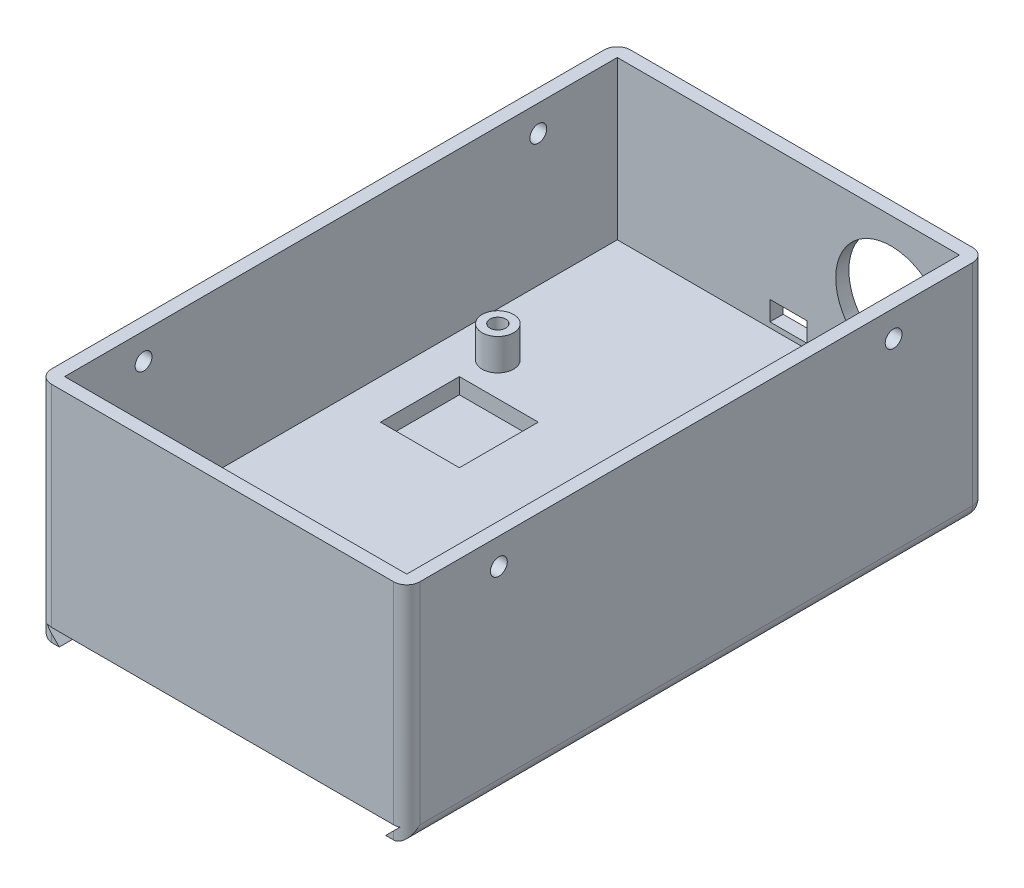
from build123d import *

# Parameters (mm, degrees)
SKETCH3_W           = 70
SKETCH3_H           = 110
BOSS_EXTRUDE1_DEPTH = 3
SKETCH4_W           = 2.5
SKETCH4_H           = 105
BOSS_EXTRUDE2_DEPTH = 30
SKETCH5_R           = 3
BOSS_EXTRUDE3_DEPTH = 6
SKETCH7_W           = 70
SKETCH7_H           = 110
SKETCH7_W_2         = 65
SKETCH7_H_2         = 52.5
SKETCH7_H_3         = 50
BOSS_EXTRUDE4_DEPTH = 9.5
SKETCH8_W           = 15
SKETCH8_H           = 6
CUT_EXTRUDE2_DEPTH  = 2.5
SKETCH9_W           = 15
SKETCH9_H           = 15
CUT_EXTRUDE3_DEPTH  = 3
SKETCH10_W          = 1.5
SKETCH10_H          = 50
BOSS_EXTRUDE5_DEPTH = 9.5
SKETCH11_W          = 31
SKETCH11_H          = 2.5
CUT_EXTRUDE5_DEPTH  = 52.5
SKETCH12_R          = 3.5
BOSS_EXTRUDE6_DEPTH = 7
SKETCH15_R          = 1.5
CUT_EXTRUDE6_DEPTH  = 6
SKETCH16_W          = 65
SKETCH16_H          = 2.5
BOSS_EXTRUDE7_DEPTH = 52.5
SKETCH17_R          = 1.6
CUT_EXTRUDE7_DEPTH  = 95.942087611
SKETCH18_W          = 7
SKETCH18_H          = 3.7
CUT_EXTRUDE8_DEPTH  = 2.5
SKETCH19_R          = 1.5
CUT_EXTRUDE9_DEPTH  = 6
SKETCH20_R          = 10.5
CUT_EXTRUDE10_DEPTH = 2.5
FILLET2_R           = 2.5
FILLET3_R           = 2.5


with BuildPart() as part:
    # Sketch3 → Boss-Extrude1 (new body)
    with BuildSketch(Plane(origin=(0, 0, 0), x_dir=(1, 0, 0), z_dir=(0, 1, 0))):
        Rectangle(SKETCH3_W, SKETCH3_H)
    extrude(amount=BOSS_EXTRUDE1_DEPTH)

    # Sketch4 → Boss-Extrude2 (add)
    with BuildSketch(Plane(origin=(0, 3, 0), x_dir=(1, 0, 0), z_dir=(0, 1, 0))):
        with Locations((-33.75, 0)):
            Rectangle(SKETCH4_W, SKETCH4_H)
        Polygon((35, 55), (-35, 55), (-35, 52.5), (-32.5, 52.5), (32.5, 52.5), (35, 52.5), align=None)
        Polygon((35, -55), (35, 52.5), (32.5, 52.5), (32.5, -52.5), (32.5, -55), align=None)
        Polygon((-32.5, -52.5), (-35, -52.5), (-35, -55), (32.5, -55), (32.5, -52.5), align=None)
    extrude(amount=BOSS_EXTRUDE2_DEPTH)

    # Sketch5 → Boss-Extrude3 (add)
    with BuildSketch(Plane(origin=(0, 3, 0), x_dir=(1, 0, 0), z_dir=(0, 1, 0))):
        with Locations(Location((-24.06, 21.37, 0), (0, 0, 90))):
            Circle(SKETCH5_R)
        with Locations(Location((23.57, 21.37, 0), (0, 0, 90))):
            Circle(SKETCH5_R)
        with Locations(Location((23.57, -45.31, 0), (0, 0, 90))):
            Circle(SKETCH5_R)
        with Locations(Location((-24.06, -45.31, 0), (0, 0, 90))):
            Circle(SKETCH5_R)
    extrude(amount=BOSS_EXTRUDE3_DEPTH)

    # Sketch7 → Boss-Extrude4 (add)
    with BuildSketch(Plane.XZ):
        Rectangle(SKETCH7_W, SKETCH7_H)
        with Locations((0, -26.25)):
            Rectangle(SKETCH7_W_2, SKETCH7_H_2, mode=Mode.SUBTRACT)
        with Locations((0, 27.5)):
            Rectangle(SKETCH7_W_2, SKETCH7_H_3, mode=Mode.SUBTRACT)
    extrude(amount=BOSS_EXTRUDE4_DEPTH)

    # Sketch8 → Cut-Extrude2 (cut)
    with BuildSketch(Plane.XY.offset(2.5)):
        with Locations((17.5, -3)):
            Rectangle(SKETCH8_W, SKETCH8_H)
        with Locations((-17.5, -3)):
            Rectangle(SKETCH8_W, SKETCH8_H)
    extrude(amount=-CUT_EXTRUDE2_DEPTH, mode=Mode.SUBTRACT)

    # Sketch9 → Cut-Extrude3 (cut)
    with BuildSketch(Plane.XZ):
        with Locations((-17.5, -7.5)):
            Rectangle(SKETCH9_W, SKETCH9_H)
        with Locations((17.5, -7.5)):
            Rectangle(SKETCH9_W, SKETCH9_H)
    extrude(amount=-CUT_EXTRUDE3_DEPTH, mode=Mode.SUBTRACT)

    # Sketch10 → Boss-Extrude5 (add)
    with BuildSketch(Plane.XZ):
        with Locations((-31.75, 27.5)):
            Rectangle(SKETCH10_W, SKETCH10_H)
        with Locations((31.75, 27.5)):
            Rectangle(SKETCH10_W, SKETCH10_H)
    extrude(amount=BOSS_EXTRUDE5_DEPTH)

    # Sketch11 → Cut-Extrude5 (cut)
    with BuildSketch(Plane.XY.offset(55)):
        with Locations((-15.5, -8.25)):
            Rectangle(SKETCH11_W, SKETCH11_H)
        Polygon((-33.5, -7), (-31, -9.5), (-31, -7), align=None)
        with Locations((15.5, -8.25)):
            Rectangle(SKETCH11_W, SKETCH11_H)
        Polygon((31, -7), (31, -9.5), (33.5, -7), align=None)
    extrude(amount=-CUT_EXTRUDE5_DEPTH, mode=Mode.SUBTRACT)

    # Sketch12 → Boss-Extrude6 (add)
    with BuildSketch(Plane.XZ):
        with Locations(Location((0, 48, 0), (0, 0, 270))):
            Circle(SKETCH12_R)
    extrude(amount=BOSS_EXTRUDE6_DEPTH)

    # Sketch15 → Cut-Extrude6 (cut)
    with BuildSketch(Plane.XZ.offset(7)):
        with Locations(Location((0, 48, 0), (0, 0, 270))):
            Circle(SKETCH15_R)
    extrude(amount=-CUT_EXTRUDE6_DEPTH, mode=Mode.SUBTRACT)

    # Sketch16 → Boss-Extrude7 (add)
    with BuildSketch(Plane.XY.offset(-52.5)):
        with Locations((0, -8.25)):
            Rectangle(SKETCH16_W, SKETCH16_H)
    extrude(amount=BOSS_EXTRUDE7_DEPTH)

    # Sketch17 → Cut-Extrude7 (cut, through all)
    with BuildSketch(Plane.ZY.offset(35)):
        with Locations((-37.5, 28)):
            Circle(SKETCH17_R)
        with Locations((37.5, 28)):
            Circle(SKETCH17_R)
    extrude(amount=-CUT_EXTRUDE7_DEPTH, mode=Mode.SUBTRACT)

    # Sketch18 → Cut-Extrude8 (cut)
    with BuildSketch(Plane(origin=(0, 0, -55), x_dir=(-1, 0, 0), z_dir=(0, 0, -1))):
        with Locations((0, 5.85)):
            Rectangle(SKETCH18_W, SKETCH18_H)
    extrude(amount=-CUT_EXTRUDE8_DEPTH, mode=Mode.SUBTRACT)

    # Sketch19 → Cut-Extrude9 (cut)
    with BuildSketch(Plane(origin=(0, 9, 0), x_dir=(1, 0, 0), z_dir=(0, 1, 0))):
        with Locations(Location((-24.06, -45.31, 0), (0, 0, 270))):
            Circle(SKETCH19_R)
        with Locations(Location((-24.06, 21.37, 0), (0, 0, 270))):
            Circle(SKETCH19_R)
        with Locations(Location((23.57, 21.37, 0), (0, 0, 270))):
            Circle(SKETCH19_R)
        with Locations(Location((23.57, -45.31, 0), (0, 0, 270))):
            Circle(SKETCH19_R)
    extrude(amount=-CUT_EXTRUDE9_DEPTH, mode=Mode.SUBTRACT)

    # Sketch20 → Cut-Extrude10 (cut)
    with BuildSketch(Plane(origin=(0, 0, -55), x_dir=(-1, 0, 0), z_dir=(0, 0, -1))):
        with Locations((-19.5, 17.5)):
            Circle(SKETCH20_R)
    extrude(amount=-CUT_EXTRUDE10_DEPTH, mode=Mode.SUBTRACT)

    # Fillet2
    # the kernel refuses this fillet: 2.5 mm, written as the material it takes off along each edge
    with BuildSketch(Plane(origin=(-35, -15.75, -55), x_dir=(1, 0, 0), z_dir=(0, 1, 0)), Plane(origin=(35, 39.25, -55), x_dir=(-1, 0, 0), z_dir=(0, -1, 0)), Plane(origin=(35, 39.25, 55), x_dir=(0, 0, -1), z_dir=(0, -1, 0)), Plane(origin=(-35, -15.75, 55), x_dir=(0, 0, -1), z_dir=(0, 1, 0))) as fillet2_piece_1:
        with BuildLine():
            CenterArc((FILLET2_R, -FILLET2_R), FILLET2_R, 90, 90)
            Line((0, -FILLET2_R), (0, 0))
            Line((0, 0), (FILLET2_R, 0))
        make_face()
    extrude(amount=55, mode=Mode.SUBTRACT)

    # Fillet3
    # the kernel refuses this fillet: 2.5 mm, written as the material it takes off along each edge
    with BuildSketch(Plane(origin=(-32.5, -9.5, -52.5), x_dir=(-1, 0, 0), z_dir=(0, 0, 1))) as fillet3_piece_1:
        with BuildLine():
            CenterArc((2.5 - FILLET3_R, -FILLET3_R), FILLET3_R, 0, 90)
            Line((2.5, -FILLET3_R), (2.5, 0))
            Line((2.5, 0), (2.5 - FILLET3_R, 0))
        make_face()
    revolve(axis=Axis((-32.5, -9.5, -52.5), (0, -1, 0)), revolution_arc=90, mode=Mode.SUBTRACT)
    with BuildSketch(Plane(origin=(32.5, -9.5, -52.5), x_dir=(1, 0, 0), z_dir=(0, 0, 1))) as fillet3_piece_2:
        with BuildLine():
            CenterArc((2.5 - FILLET3_R, FILLET3_R), FILLET3_R, 270, 90)
            Line((2.5 - FILLET3_R, 0), (2.5, 0))
            Line((2.5, 0), (2.5, FILLET3_R))
        make_face()
    revolve(axis=Axis((32.5, -9.5, -52.5), (0, 1, 0)), revolution_arc=90, mode=Mode.SUBTRACT)
    with BuildSketch(Plane(origin=(35, -9.5, -52.5), x_dir=(-1, 0, 0), z_dir=(0, 0, 1)), Plane(origin=(-35, -9.5, 58.75), x_dir=(1, 0, 0), z_dir=(0, 0, -1))) as fillet3_piece_3:
        with BuildLine():
            CenterArc((FILLET3_R, -FILLET3_R), FILLET3_R, 90, 90)
            Line((0, -FILLET3_R), (0, 0))
            Line((0, 0), (FILLET3_R, 0))
        make_face()
    extrude(amount=111.25, mode=Mode.SUBTRACT)
    with BuildSketch(Plane(origin=(-32.5, -9.5, -55), x_dir=(0, 1, 0), z_dir=(1, 0, 0))) as fillet3_piece_4:
        with BuildLine():
            CenterArc((FILLET3_R, FILLET3_R), FILLET3_R, 180, 90)
            Line((0, FILLET3_R), (0, 0))
            Line((0, 0), (FILLET3_R, 0))
        make_face()
    extrude(amount=65, mode=Mode.SUBTRACT)


solid = part.part
